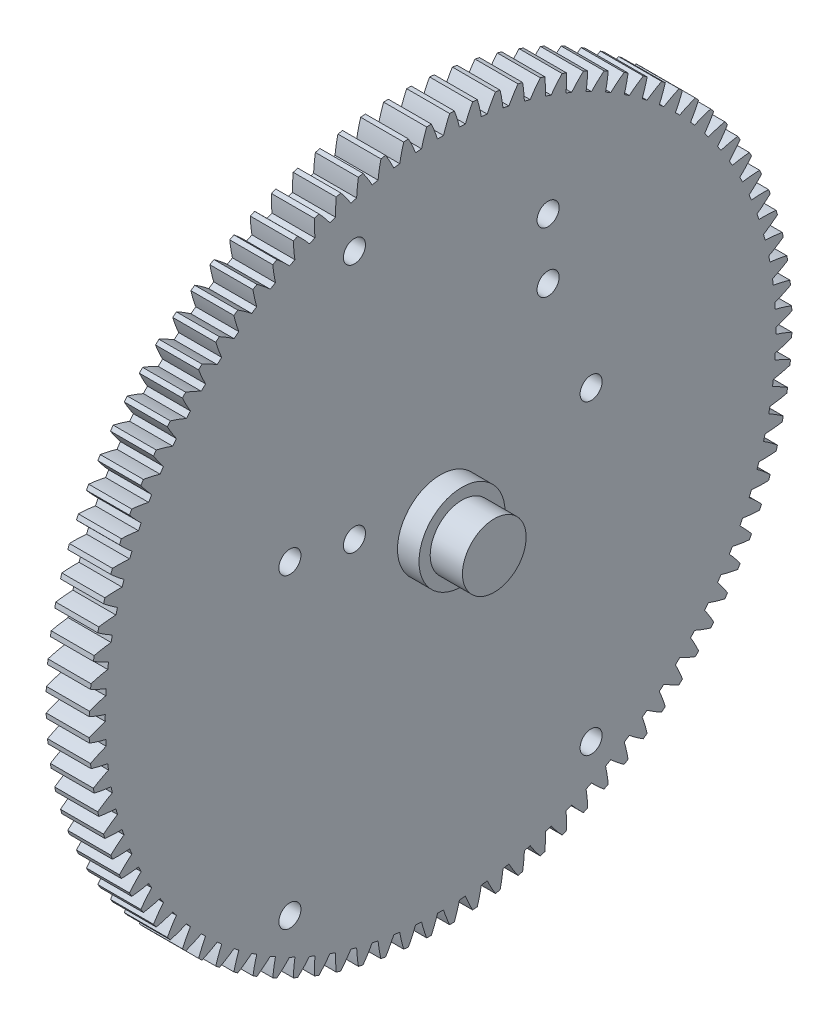
from build123d import *

# Parameters (mm, degrees)
BASPROSKE_W         = 12.7
BASPROSKE_H         = 103.716666667
TOOTHCUT_DEPTH      = 148.226301621
TEETHCUTS_COUNT     = 96
TEETHCUTS_ANGLE     = 356.25
SKETCH1_R           = 12.7
BOSS_EXTRUDE1_DEPTH = 6.35
SKETCH2_R           = 9.398
BOSS_EXTRUDE2_DEPTH = 9.525
SKETCH3_R           = 3.2512
CUT_EXTRUDE1_DEPTH  = 150.38633046


with BuildPart() as part:
    # BasProSke → Base-Revolve (revolve)
    with BuildSketch(Plane(origin=(0, 0, 0), x_dir=(1, 0, 0), z_dir=(0, 1, 0))):
        with Locations((6.35, 51.858333334)):
            Rectangle(BASPROSKE_W, BASPROSKE_H)
    revolve(axis=Axis((-10, 0, 0), (1, 0, 0)))

    # TooCutSke → ToothCut (cut, through all)
    with BuildSketch(Plane(origin=(0, 0, 0), x_dir=(0, 0, -1), z_dir=(1, 0, 0))):
        with BuildLine():
            ThreePointArc((0.888460643, 98.94890801), (0, 98.952896667), (-0.888460643, 98.94890801))
            ThreePointArc((-0.888460643, 98.94890801), (-1.723888784, 101.356350909), (-2.708555931, 103.706702392))
            ThreePointArc((-2.708555931, 103.706702392), (0, 103.742066667), (2.708555931, 103.706702392))
            ThreePointArc((2.708555931, 103.706702392), (1.723888784, 101.356350909), (0.888460643, 98.94890801))
        make_face()
    toothcut = extrude(amount=TOOTHCUT_DEPTH, mode=Mode.SUBTRACT)

    # TeethCuts: ToothCut ×96 about axis
    teethcuts_axis = Axis((-10, 0, 0), (1, 0, 0))
    for i in range(1, TEETHCUTS_COUNT):
        add(toothcut.rotate(teethcuts_axis, i * TEETHCUTS_ANGLE / (TEETHCUTS_COUNT - 1)), mode=Mode.SUBTRACT)

    # Sketch1 → Boss-Extrude1 (add)
    with BuildSketch(Plane(origin=(12.7, 0, 0), x_dir=(0, 0, -1), z_dir=(1, 0, 0))):
        Circle(SKETCH1_R)
    extrude(amount=BOSS_EXTRUDE1_DEPTH)

    # Sketch2 → Boss-Extrude2 (add)
    with BuildSketch(Plane(origin=(19.05, 0, 0), x_dir=(0, 0, -1), z_dir=(1, 0, 0))):
        Circle(SKETCH2_R)
    extrude(amount=BOSS_EXTRUDE2_DEPTH)

    # Sketch3 → Cut-Extrude1 (cut, through all)
    with BuildSketch(Plane.ZY):
        with Locations((44.45, 12.7)):
            Circle(SKETCH3_R)
        with Locations((44.45, -77.724)):
            Circle(SKETCH3_R)
        with Locations((-44.45, 12.7)):
            Circle(SKETCH3_R)
        with Locations((-44.45, -77.724)):
            Circle(SKETCH3_R)
        with Locations((25.4, 82.55)):
            Circle(SKETCH3_R)
        with Locations((25.4, 8.89)):
            Circle(SKETCH3_R)
        with Locations((-31.75, 63.5)):
            Circle(SKETCH3_R)
        with Locations((-31.75, 45.72)):
            Circle(SKETCH3_R)
    extrude(amount=-CUT_EXTRUDE1_DEPTH, mode=Mode.SUBTRACT)


solid = part.part
